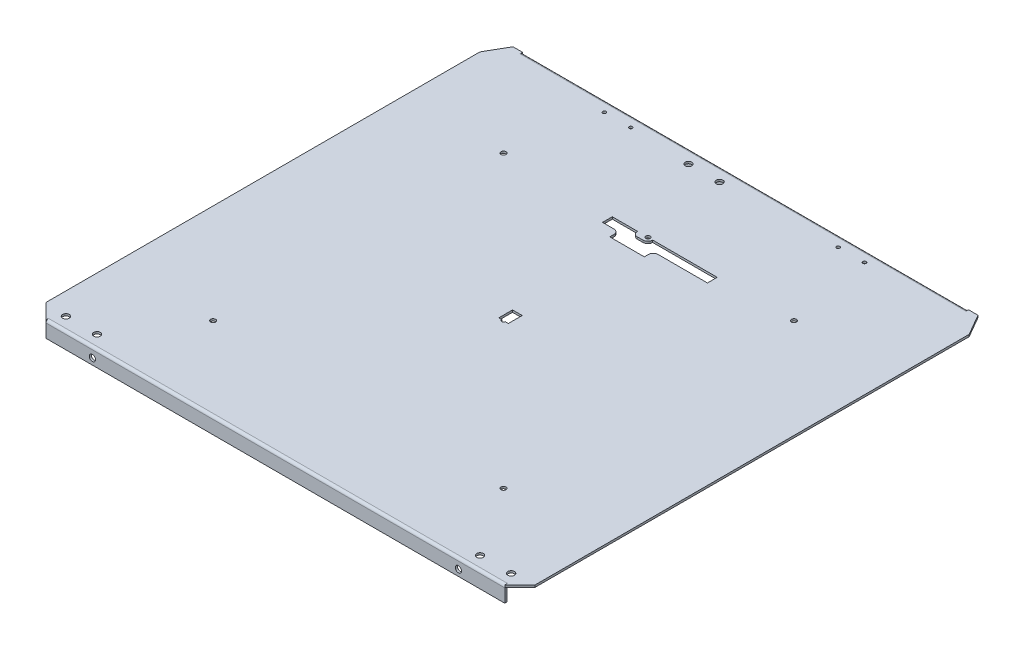
from build123d import *

# Parameters (mm, degrees)
SKETCH1_W                      = 350
SKETCH1_H                      = 340
BASE_FLANGE1_DEPTH             = 1.51892
M3_CLEARANCE_HOLE1_D           = 3.6
M4_CLEARANCE_HOLE1_D           = 4.8
SKETCH41_W                     = 340
SKETCH41_H                     = 1.51892
BOSS_EXTRUDE4_DEPTH            = 1.905
SKETCH42_W                     = 340
SKETCH42_H                     = 1.51892
BOSS_EXTRUDE5_DEPTH            = 1.905
CUT_EXTRUDE3_DEPTH             = 1.51892
SKETCH51_R                     = 1.55
SKETCH51_R_2                   = 1.27
SKETCH51_W                     = 46.695999999
SKETCH51_H                     = 7.064
SKETCH51_W_2                   = 18.24
CUT_EXTRUDE4_DEPTH             = 1.51892
CHAMFER1_SIZE                  = 11
SKETCH62_W                     = 25
SKETCH62_H                     = 10
SKETCH62_W_2                   = 7
CUT_EXTRUDE6_DEPTH             = 1.51892
FILLET4_R                      = 3.5
EDGE_FLANGE4_STRIP_W           = 6.83768
EDGE_FLANGE4_STRIP_H           = 1.51892
EDGE_FLANGE4_STRIP_CUT_DEPTH   = 331.81
EDGE_FLANGE4_STRIP_2_W         = 6.83768
EDGE_FLANGE4_STRIP_2_H         = 1.51892
EDGE_FLANGE4_STRIP_CUT_2_DEPTH = 322.430780628
EDGE_FLANGE4_DEPTH             = 331.81
EDGE_FLANGE4_BEND_DEPTH        = 322.430780628
M2_CLEARANCE_HOLE1_D           = 2.4
M4_CLEARANCE_HOLE3_D           = 4.5
M4_CLEARANCE_HOLE3_DEPTH       = 11.5189
M4_CLEARANCE_HOLE3_TIP         = 1.351936393
M4_CLEARANCE_HOLE4_D           = 4.5
M4_CLEARANCE_HOLE4_DEPTH       = 11.5189
M4_CLEARANCE_HOLE4_TIP         = 1.351936393


# Sheet-metal steps are written as plain solids
with BuildPart() as part:
    # Sketch1 → Base-Flange1 (new body)
    with BuildSketch(Plane(origin=(0, 0, 0), x_dir=(1, 0, 0), z_dir=(0, 1, 0))):
        with Locations((0, 5)):
            Rectangle(SKETCH1_W, SKETCH1_H)
    extrude(amount=-BASE_FLANGE1_DEPTH)

    # M3 Clearance Hole1 (through all)
    with Locations(Plane(origin=(0, 0, 0), x_dir=(1, 0, 0), z_dir=(0, 1, 0))):
        with Locations((-105, 105), (105, 105), (105, -105), (-105, -105)):
            Hole(M3_CLEARANCE_HOLE1_D / 2)

    # M4 Clearance Hole1 (through all)
    with Locations(Plane(origin=(0, -1.51892, 0), x_dir=(-1, 0, 0), z_dir=(0, -1, 0))):
        with Locations((-161.000000003, -155.500000003), (31.25, 165), (8.75, 165), (138.500000003, -155.500000003), (161.000000003, -155.500000003), (-138.500000003, -155.500000003)):
            Hole(M4_CLEARANCE_HOLE1_D / 2)

    # Sketch41 → Boss-Extrude4 (add)
    with BuildSketch(Plane(origin=(175, 0, 0), x_dir=(0, 0, -1), z_dir=(1, 0, 0))):
        with Locations((5, -0.75946)):
            Rectangle(SKETCH41_W, SKETCH41_H)
    extrude(amount=BOSS_EXTRUDE4_DEPTH)

    # Sketch42 → Boss-Extrude5 (add)
    with BuildSketch(Plane.ZY.offset(175)):
        with Locations((-5, -0.75946)):
            Rectangle(SKETCH42_W, SKETCH42_H)
    extrude(amount=BOSS_EXTRUDE5_DEPTH)

    # Sketch50 → Cut-Extrude3 (cut)
    with BuildSketch(Plane(origin=(0, 0, 0), x_dir=(1, 0, 0), z_dir=(0, 1, 0))):
        Polygon((-176.905, 175), (-168.143593544, 175), (-176.905, 159.824798873), align=None)
        Polygon((168.143593544, 175), (176.905, 159.824798873), (176.905, 175), align=None)
    extrude(amount=-CUT_EXTRUDE3_DEPTH, mode=Mode.SUBTRACT)

    # Sketch51 → Cut-Extrude4 (cut)
    with BuildSketch(Plane(origin=(0, 0, 0), x_dir=(1, 0, 0), z_dir=(0, 1, 0))):
        with Locations(Location((0, 104.499999999, 0), (0, 0, 270))):
            Circle(SKETCH51_R)
        with Locations(Location((0, 0, 0), (0, 0, 270))):
            Circle(SKETCH51_R_2)
        with Locations((26.760000001, 100.904)):
            Rectangle(SKETCH51_W, SKETCH51_H)
        with Locations((-16.67, 100.904)):
            Rectangle(SKETCH51_W_2, SKETCH51_H)
    extrude(amount=-CUT_EXTRUDE4_DEPTH, mode=Mode.SUBTRACT)

    # Chamfer1
    chamfer1_edges = [part.edges().sort_by_distance(p)[0] for p in [
        (176.905, -0.75946, 165),
        (-176.905, -0.75946, 165),
    ]]
    chamfer(chamfer1_edges, length=CHAMFER1_SIZE)

    # Sketch62 → Cut-Extrude6 (cut)
    with BuildSketch(Plane(origin=(0, 0, 0), x_dir=(1, 0, 0), z_dir=(0, 1, 0))):
        with Locations((-1.587999999, 95.904)):
            Rectangle(SKETCH62_W, SKETCH62_H)
        with Locations((0, 5)):
            Rectangle(SKETCH62_W_2, SKETCH62_H)
    extrude(amount=-CUT_EXTRUDE6_DEPTH, mode=Mode.SUBTRACT)

    # Fillet4
    fillet4_edges = [part.edges().sort_by_distance(p)[0] for p in [
        (-14.087999999, -0.75946, -97.372),
        (-7.55, -0.75946, -100.904),
        (10.912000001, -0.75946, -97.372),
        (3.412000001, -0.75946, -100.904),
    ]]
    fillet(fillet4_edges, radius=FILLET4_R)

    # Edge-Flange4 strip (across the edge) → Edge-Flange4 strip cut (cut)
    with BuildSketch(Plane(origin=(165.905, -1.51892, 165), x_dir=(0, 0, -1), z_dir=(-1, 0, 0))):
        with Locations((-1.51892, -0.75946)):
            Rectangle(EDGE_FLANGE4_STRIP_W, EDGE_FLANGE4_STRIP_H)
    extrude(amount=EDGE_FLANGE4_STRIP_CUT_DEPTH, mode=Mode.SUBTRACT)

    # Edge-Flange4 strip 2 (across the edge) → Edge-Flange4 strip cut 2 (cut)
    with BuildSketch(Plane(origin=(-161.215390314, -1.51892, -175), x_dir=(0, 0, 1), z_dir=(1, 0, 0))):
        with Locations((-1.51892, -0.75946)):
            Rectangle(EDGE_FLANGE4_STRIP_2_W, EDGE_FLANGE4_STRIP_2_H)
    extrude(amount=EDGE_FLANGE4_STRIP_CUT_2_DEPTH, mode=Mode.SUBTRACT)

    # Edge-Flange4 section (across the edge) → Edge-Flange4 (add)
    with BuildSketch(Plane(origin=(165.905, -1.51892, 165), x_dir=(0, 0, -1), z_dir=(-1, 0, 0))):
        with BuildLine():
            Line((0, 0.381), (0, 10))
            Line((0, 10), (1.51892, 10))
            Line((1.51892, 10), (1.51892, 0.381))
            ThreePointArc((1.51892, 0.381), (1.630512316, 0.111592316), (1.89992, 0))
            Line((1.89992, 0), (1.89992, -1.51892))
            ThreePointArc((1.89992, -1.51892), (0.556473684, -0.962446316), (0, 0.381))
        make_face()
    extrude(amount=EDGE_FLANGE4_DEPTH)

    # Edge-Flange4 section 2 (across the edge) → Edge-Flange4 bend (add)
    with BuildSketch(Plane(origin=(-161.215390314, -1.51892, -175), x_dir=(0, 0, 1), z_dir=(1, 0, 0))):
        with BuildLine():
            Line((0, 0.381), (0, 10))
            Line((0, 10), (1.51892, 10))
            Line((1.51892, 10), (1.51892, 0.381))
            ThreePointArc((1.51892, 0.381), (1.630512316, 0.111592316), (1.89992, 0))
            Line((1.89992, 0), (1.89992, -1.51892))
            ThreePointArc((1.89992, -1.51892), (0.556473684, -0.962446316), (0, 0.381))
        make_face()
    extrude(amount=EDGE_FLANGE4_BEND_DEPTH)

    # M2 Clearance Hole1 (through all)
    with Locations(Plane(origin=(0, 0, 0), x_dir=(1, 0, 0), z_dir=(0, 1, 0))):
        with Locations((-94.05, 167), (-75, 167), (75, 167), (94.05, 167)):
            Hole(M2_CLEARANCE_HOLE1_D / 2)

    # M4 Clearance Hole3
    with Locations(Plane.XY.offset(165)):
        with Locations((132.349919958, -7), (-132.349919958, -7)):
            Hole(M4_CLEARANCE_HOLE3_D / 2, depth=M4_CLEARANCE_HOLE3_DEPTH)
            with Locations((0, 0, -(M4_CLEARANCE_HOLE3_DEPTH + M4_CLEARANCE_HOLE3_TIP / 2))):  # 118° drill point
                Cone(0, M4_CLEARANCE_HOLE3_D / 2, M4_CLEARANCE_HOLE3_TIP, mode=Mode.SUBTRACT)

    # M4 Clearance Hole4
    with Locations(Plane(origin=(0, 0, -175), x_dir=(-1, 0, 0), z_dir=(0, 0, -1))):
        with Locations((0, -6.5)):
            Hole(M4_CLEARANCE_HOLE4_D / 2, depth=M4_CLEARANCE_HOLE4_DEPTH)
            with Locations((0, 0, -(M4_CLEARANCE_HOLE4_DEPTH + M4_CLEARANCE_HOLE4_TIP / 2))):  # 118° drill point
                Cone(0, M4_CLEARANCE_HOLE4_D / 2, M4_CLEARANCE_HOLE4_TIP, mode=Mode.SUBTRACT)


solid = part.part
